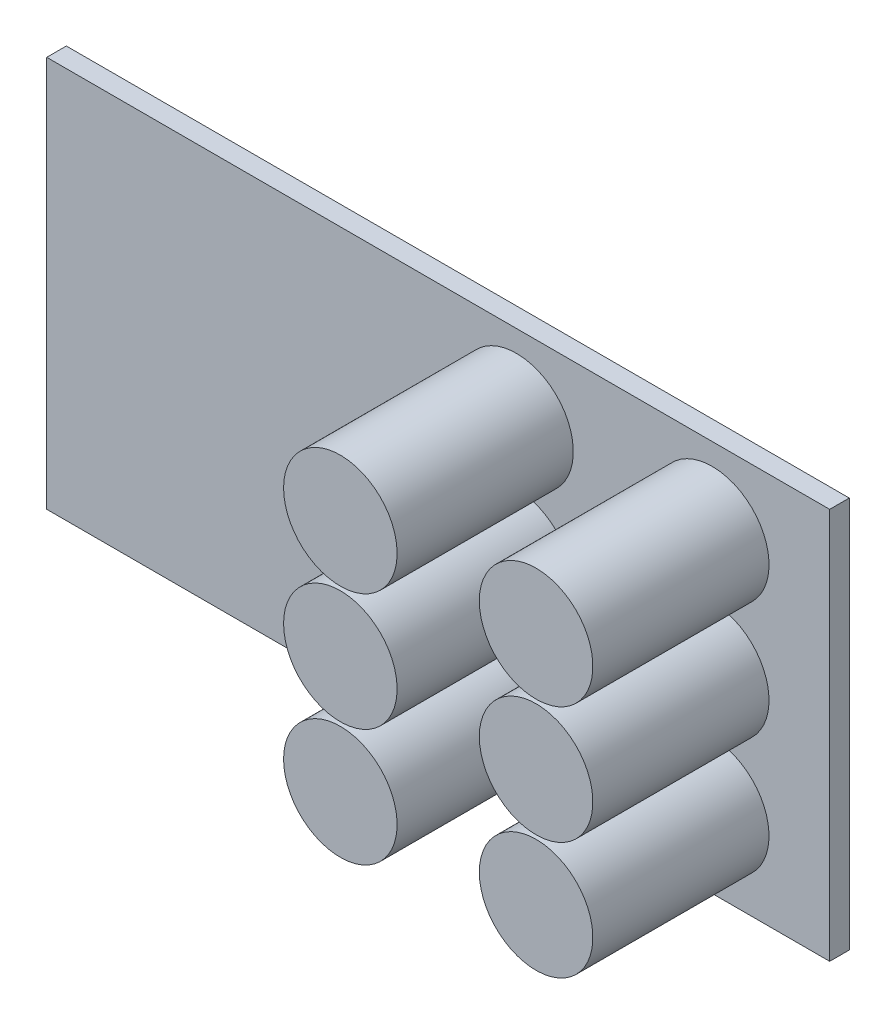
from build123d import *

# Parameters (mm, degrees)
ESBO_O1_W                   = 200
ESBO_O1_H                   = 100
RESSALTO_EXTRUS_O1_DEPTH    = 5
ESBO_O12_R                  = 14.5
RESSALTO_EXTRUS_O14_DEPTH   = 45
RESSALTO_EXTRUS_O14_2_DEPTH = 45
RESSALTO_EXTRUS_O14_3_DEPTH = 45
RESSALTO_EXTRUS_O14_4_DEPTH = 45
RESSALTO_EXTRUS_O14_5_DEPTH = 45
RESSALTO_EXTRUS_O14_6_DEPTH = 45
ESBO_O11_R                  = 12.5
CORTE_EXTRUS_O8_DEPTH       = 45
ESBO_O11_5_R                = 12.5
CORTE_EXTRUS_O9_DEPTH       = 45


with BuildPart() as part:
    # Esboço1 → Ressalto-extrusão1 (new body)
    with BuildSketch(Plane.XY):
        Rectangle(ESBO_O1_W, ESBO_O1_H)
    extrude(amount=RESSALTO_EXTRUS_O1_DEPTH)


with BuildPart() as body_2:
    # Esboço12 → Ressalto-extrusão14 (new body)
    with BuildSketch(Plane.XY.offset(5)):
        with Locations((20, 30)):
            Circle(ESBO_O12_R)
    extrude(amount=RESSALTO_EXTRUS_O14_DEPTH)


with BuildPart() as body_3:
    # Esboço12 → Ressalto-extrus_o14 2 (new body)
    with BuildSketch(Plane.XY.offset(5)):
        with Locations((70, 30)):
            Circle(ESBO_O12_R)
    extrude(amount=RESSALTO_EXTRUS_O14_2_DEPTH)


with BuildPart() as body_4:
    # Esboço12 → Ressalto-extrus_o14 3 (new body)
    with BuildSketch(Plane.XY.offset(5)):
        with Locations((20, 0)):
            Circle(ESBO_O12_R)
    extrude(amount=RESSALTO_EXTRUS_O14_3_DEPTH)


with BuildPart() as body_5:
    # Esboço12 → Ressalto-extrus_o14 4 (new body)
    with BuildSketch(Plane.XY.offset(5)):
        with Locations((70, 0)):
            Circle(ESBO_O12_R)
    extrude(amount=RESSALTO_EXTRUS_O14_4_DEPTH)


with BuildPart() as body_6:
    # Esboço12 → Ressalto-extrus_o14 5 (new body)
    with BuildSketch(Plane.XY.offset(5)):
        with Locations((70, -30)):
            Circle(ESBO_O12_R)
    extrude(amount=RESSALTO_EXTRUS_O14_5_DEPTH)


with BuildPart() as body_7:
    # Esboço12 → Ressalto-extrus_o14 6 (new body)
    with BuildSketch(Plane.XY.offset(5)):
        with Locations((20, -30)):
            Circle(ESBO_O12_R)
    extrude(amount=RESSALTO_EXTRUS_O14_6_DEPTH)


with BuildPart() as corte_extrus_o8_tool:
    # Esboço11 → Corte-extrusão8 (new body)
    with BuildSketch(Plane(origin=(0, 0, 0), x_dir=(-1, 0, 0), z_dir=(0, 0, -1))):
        with Locations((-70, 30)):
            Circle(ESBO_O11_R)
    extrude(amount=-CORTE_EXTRUS_O8_DEPTH)


with BuildPart() as part_1:
    add(part.part)

    # Corte-extrusão8: cut by corte_extrus_o8_tool
    add(corte_extrus_o8_tool.part, mode=Mode.SUBTRACT)


with BuildPart() as body_3_1:
    add(body_3.part)

    # Corte-extrusão8: cut by corte_extrus_o8_tool
    add(corte_extrus_o8_tool.part, mode=Mode.SUBTRACT)


with BuildPart() as corte_extrus_o9_tool:
    # Esboço11<5> → Corte-extrusão9 (new body)
    with BuildSketch(Plane(origin=(0, 0, 0), x_dir=(-1, 0, 0), z_dir=(0, 0, -1))):
        with Locations((-20, -30)):
            Circle(ESBO_O11_5_R)
        with Locations((-70, -30)):
            Circle(ESBO_O11_5_R)
        with Locations((-70, 0)):
            Circle(ESBO_O11_5_R)
        with Locations((-20, 30)):
            Circle(ESBO_O11_5_R)
        with Locations((-20, 0)):
            Circle(ESBO_O11_5_R)
    extrude(amount=-CORTE_EXTRUS_O9_DEPTH)


with BuildPart() as part_2:
    add(part_1.part)

    # Corte-extrusão9: cut by corte_extrus_o9_tool
    add(corte_extrus_o9_tool.part, mode=Mode.SUBTRACT)


with BuildPart() as body_2_1:
    add(body_2.part)

    # Corte-extrusão9: cut by corte_extrus_o9_tool
    add(corte_extrus_o9_tool.part, mode=Mode.SUBTRACT)


with BuildPart() as body_4_1:
    add(body_4.part)

    # Corte-extrusão9: cut by corte_extrus_o9_tool
    add(corte_extrus_o9_tool.part, mode=Mode.SUBTRACT)


with BuildPart() as body_5_1:
    add(body_5.part)

    # Corte-extrusão9: cut by corte_extrus_o9_tool
    add(corte_extrus_o9_tool.part, mode=Mode.SUBTRACT)


with BuildPart() as body_6_1:
    add(body_6.part)

    # Corte-extrusão9: cut by corte_extrus_o9_tool
    add(corte_extrus_o9_tool.part, mode=Mode.SUBTRACT)


with BuildPart() as body_7_1:
    add(body_7.part)

    # Corte-extrusão9: cut by corte_extrus_o9_tool
    add(corte_extrus_o9_tool.part, mode=Mode.SUBTRACT)


solid = Compound([body_3_1.part, part_2.part, body_2_1.part, body_4_1.part, body_5_1.part, body_6_1.part, body_7_1.part])
